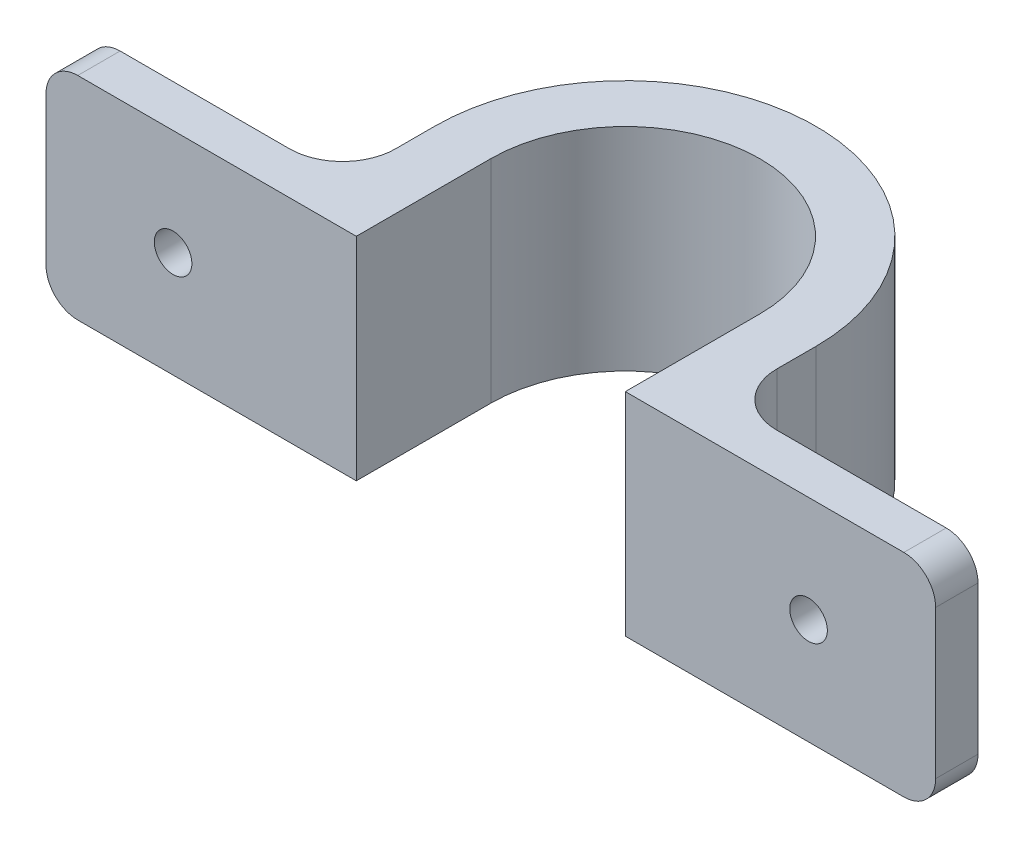
from build123d import *

# Parameters (mm, degrees)
BOSS_EXTRUDE1_DEPTH = 20
SKETCH2_R           = 1.775
CUT_EXTRUDE1_DEPTH  = 91.381911907
FILLET1_R           = 3
FILLET2_R           = 5


with BuildPart() as part:
    # Sketch1 → Boss-Extrude1 (new body)
    with BuildSketch(Plane(origin=(0, 0, 0), x_dir=(1, 0, 0), z_dir=(0, 1, 0))):
        with BuildLine():
            Line((0, 0), (0, 4))
            Line((0, 4), (24, 4))
            Line((24, 4), (24, 12.7))
            ThreePointArc((24, 12.7), (42, 30.7), (60, 12.7))
            Line((60, 12.7), (60, 4))
            Line((60, 4), (84, 4))
            Line((84, 4), (84, 0))
            Line((84, 0), (54.7, 0))
            Line((54.7, 0), (54.7, 12.7))
            ThreePointArc((54.7, 12.7), (42, 25.4), (29.3, 12.7))
            Line((29.3, 12.7), (29.3, 0))
            Line((29.3, 0), (0, 0))
        make_face()
    extrude(amount=BOSS_EXTRUDE1_DEPTH)

    # Sketch2 → Cut-Extrude1 (cut, through all)
    with BuildSketch(Plane(origin=(0, 0, -4), x_dir=(-1, 0, 0), z_dir=(0, 0, -1))):
        with Locations((-72, 10)):
            Circle(SKETCH2_R)
        with Locations((-12, 10)):
            Circle(SKETCH2_R)
    extrude(amount=-CUT_EXTRUDE1_DEPTH, mode=Mode.SUBTRACT)

    # Fillet1
    fillet1_edges = [part.edges().sort_by_distance(p)[0] for p in [
        (0, 0, -2),
        (0, 20, -2),
        (84, 0, -2),
        (84, 20, -2),
    ]]
    fillet(fillet1_edges, radius=FILLET1_R)

    # Fillet2
    fillet2_edges = [part.edges().sort_by_distance(p)[0] for p in [
        (60, 10, -4),
        (24, 10, -4),
    ]]
    fillet(fillet2_edges, radius=FILLET2_R)


solid = part.part
